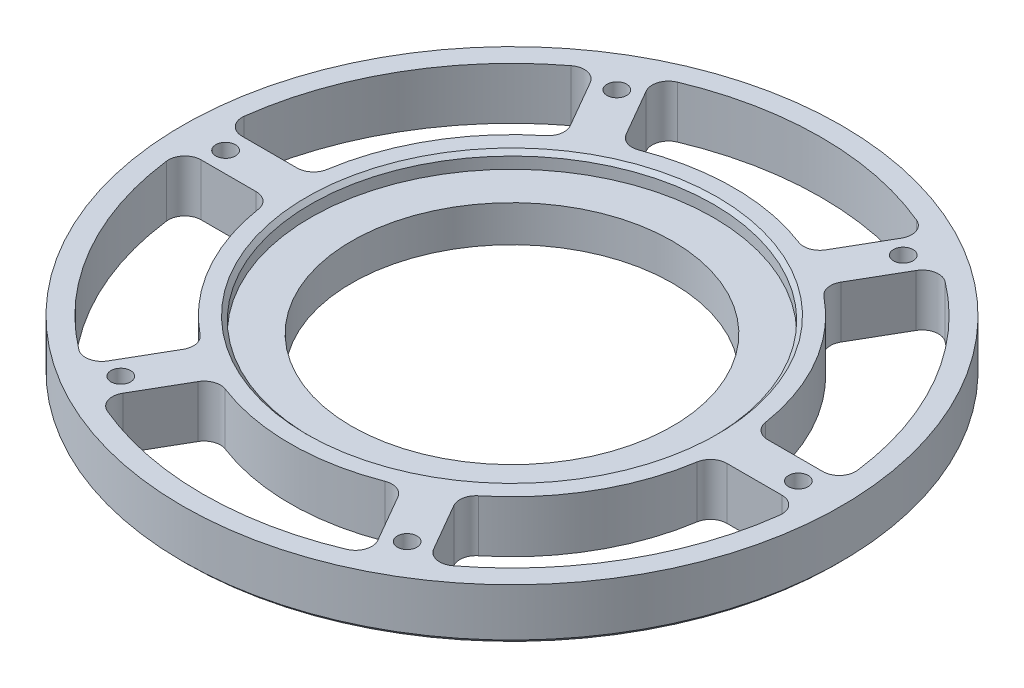
from build123d import *

# Parameters (mm, degrees)
F_12_0_189_DIAMETER_HOLE1_D = 4.8006
CIRPATTERN3_COUNT           = 6
CUT_EXTRUDE1_DEPTH          = 115.6206569515286
FILLET1_R                   = 4
CIRPATTERN4_COUNT           = 6
FILLET1_OF_CIRPATTERN4_R    = 4
CHAMFER1_SIZE               = 1
CHAMFER2_SIZE               = 1


with BuildPart() as part:
    # Sketch2 → Revolve1 (revolve)
    with BuildSketch(Plane(origin=(0, 0, 0), x_dir=(0, 0, -1), z_dir=(1, 0, 0))):
        Polygon((-39.2125, -8.7e-16), (-80.55, -5.06e-15), (-80.55, 12.699999999999994), (-49.2125, 12.699999999999994), (-49.21250000000001, 8.899999999999999), (-39.21250000000001, 8.899999999999999), align=None)
    revolve(axis=Axis((0, -0.6350000000000053, 0), (0, 1, 0)))

    # #12 (0.189) Diameter Hole1 (through all)
    with Locations(Plane(origin=(0, 12.699999999999994, 0), x_dir=(1, 0, 0), z_dir=(0, 1, 0))):
        with Locations((-35, 60.621778265)):
            f_12_0_189_diameter_hole1 = Hole(F_12_0_189_DIAMETER_HOLE1_D / 2)

    # CirPattern3: #12 (0.189) Diameter Hole1 ×6 about axis
    cirpattern3_axis = Axis((0, -0.6350000000000053, 0), (0, 1, 0))
    for i in range(1, CIRPATTERN3_COUNT):
        add(f_12_0_189_diameter_hole1.rotate(cirpattern3_axis, i * 360 / CIRPATTERN3_COUNT), mode=Mode.SUBTRACT)

    # Sketch8 → Cut-Extrude1 (cut, through all)
    with BuildSketch(Plane(origin=(0, 12.699999999999994, 0), x_dir=(1, 0, 0), z_dir=(0, 1, 0))):
        with BuildLine():
            Line((-33.36205552600358, 67.78477521597199), (-22.660589701137393, 49.249292691841845))
            ThreePointArc((-22.660589701137393, 49.249292691841845), (3.32e-15, 54.212500000000006), (22.660589701137393, 49.249292691841845))
            Line((22.660589701137393, 49.249292691841845), (33.36205552600358, 67.78477521597199))
            ThreePointArc((33.36205552600358, 67.78477521597199), (4.63e-15, 75.54999999999998), (-33.36205552600358, 67.78477521597199))
        make_face()
    cut_extrude1 = extrude(amount=-CUT_EXTRUDE1_DEPTH, mode=Mode.SUBTRACT)

    # Fillet1
    fillet1_edges = [part.edges().sort_by_distance(p)[0] for p in [
        (33.36205552600358, 6.349999999999996, -67.78477521597199),
        (22.660589701137397, 6.349999999999996, -49.249292691841845),
        (-33.36205552600357, 6.349999999999996, -67.78477521597199),
        (-22.660589701137393, 6.349999999999996, -49.249292691841845),
    ]]
    fillet(fillet1_edges, radius=FILLET1_R)

    # CirPattern4: Cut-Extrude1 ×6 about axis
    cirpattern4_axis = Axis((0, -0.6350000000000053, 0), (0, 1, 0))
    for i in range(1, CIRPATTERN4_COUNT):
        add(cut_extrude1.rotate(cirpattern4_axis, i * 360 / CIRPATTERN4_COUNT), mode=Mode.SUBTRACT)

    # Fillet1 of CirPattern4
    fillet1_of_cirpattern4_edges = [part.edges().sort_by_distance(p)[0] for p in [
        (-42.022309563847756, 6.349999999999996, -62.78477521597212),
        (-31.320843738981637, 6.349999999999996, -44.24929269184193),
        (-75.38436508985134, 6.349999999999996, -4.999999999999897),
        (-53.981433440119034, 6.349999999999996, -4.999999999999929),
        (-75.38436508985134, 6.349999999999996, 4.999999999999865),
        (-53.981433440119034, 6.349999999999996, 4.999999999999904),
        (-42.02230956384778, 6.349999999999996, 62.78477521597209),
        (-31.32084373898165, 6.349999999999996, 44.249292691841916),
        (-33.36205552600359, 6.349999999999996, 67.78477521597199),
        (-22.660589701137404, 6.349999999999996, 49.249292691841845),
        (33.362055526003566, 6.349999999999996, 67.78477521597199),
        (22.660589701137386, 6.349999999999996, 49.249292691841845),
        (42.02230956384773, 6.349999999999996, 62.78477521597213),
        (31.320843738981612, 6.349999999999996, 44.249292691841944),
        (75.38436508985134, 6.349999999999996, 4.999999999999925),
        (53.98143344011903, 6.349999999999996, 4.999999999999947),
        (75.38436508985134, 6.349999999999996, -4.99999999999989),
        (53.981433440119034, 6.349999999999996, -4.999999999999925),
        (42.022309563847756, 6.349999999999996, -62.784775215972104),
        (31.320843738981637, 6.349999999999996, -44.24929269184193),
    ]]
    fillet(fillet1_of_cirpattern4_edges, radius=FILLET1_OF_CIRPATTERN4_R)

    # Chamfer1
    chamfer1_edges = [part.edges().sort_by_distance(p)[0] for p in [
        (6.03e-15, 12.699999999999994, -49.2125),
    ]]
    chamfer(chamfer1_edges, length=CHAMFER1_SIZE)

    # Chamfer2
    chamfer2_edges = [part.edges().sort_by_distance(p)[0] for p in [
        (9.86e-15, -5.11e-15, -80.55),
    ]]
    chamfer(chamfer2_edges, length=CHAMFER2_SIZE)


solid = part.part
